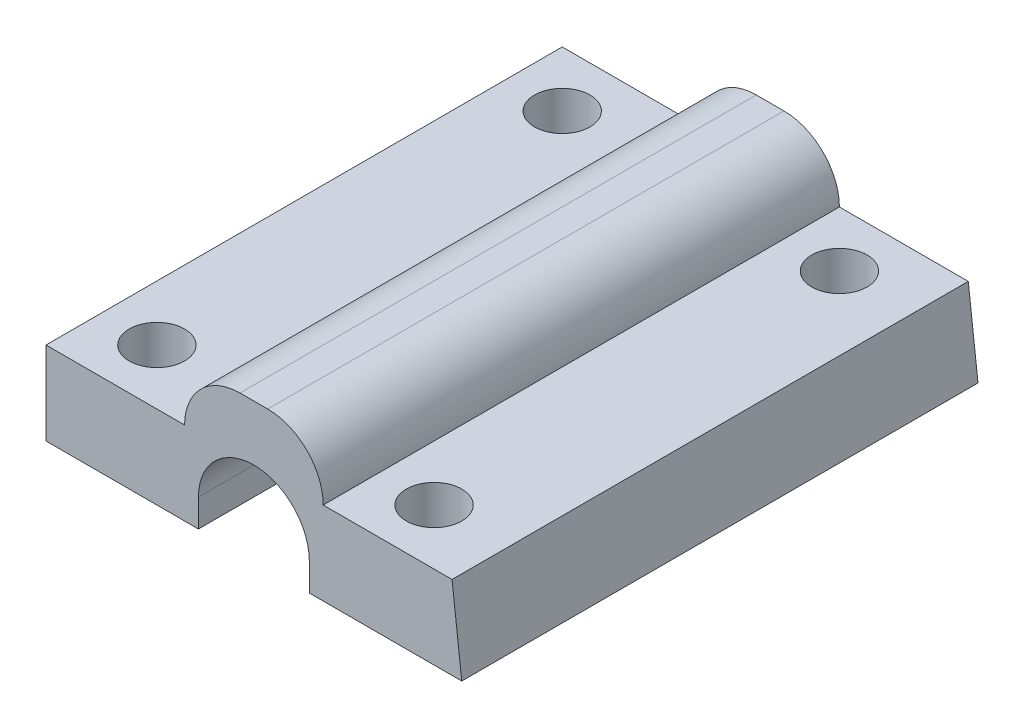
from build123d import *

# Parameters (mm, degrees)
SKETCH1_W           = 30
SKETCH1_H           = 37.25
BOSS_EXTRUDE1_DEPTH = 6
SKETCH2_R           = 2
CUT_EXTRUDE1_DEPTH  = 6
SKETCH3_W           = 10
SKETCH3_H           = 37.25
BOSS_EXTRUDE2_DEPTH = 4
SKETCH4_W           = 8
SKETCH4_H           = 37.25
CUT_EXTRUDE2_DEPTH  = 6
FILLET2_R           = 4
FILLET3_R           = 4
CUT_EXTRUDE3_DEPTH  = 50


with BuildPart() as part:
    # Sketch1 → Boss-Extrude1 (new body)
    with BuildSketch(Plane(origin=(0, 0, 0), x_dir=(1, 0, 0), z_dir=(0, 1, 0))):
        with Locations((2.786458333, -10.239583333)):
            Rectangle(SKETCH1_W, SKETCH1_H)
    extrude(amount=BOSS_EXTRUDE1_DEPTH)

    # Sketch2 → Cut-Extrude1 (cut)
    with BuildSketch(Plane(origin=(0, 6, 0), x_dir=(1, 0, 0), z_dir=(0, 1, 0))):
        with Locations(Location((-8.213541667, -24.864583333, 0), (0, 0, 270))):
            Circle(SKETCH2_R)
        with Locations(Location((11.786458333, 4.385416667, 0), (0, 0, 270))):
            Circle(SKETCH2_R)
        with Locations(Location((11.786458333, -24.864583333, 0), (0, 0, 270))):
            Circle(SKETCH2_R)
        with Locations(Location((-8.213541667, 4.385416667, 0), (0, 0, 270))):
            Circle(SKETCH2_R)
    extrude(amount=-CUT_EXTRUDE1_DEPTH, mode=Mode.SUBTRACT)

    # Sketch3 → Boss-Extrude2 (add)
    with BuildSketch(Plane(origin=(0, 6, 0), x_dir=(1, 0, 0), z_dir=(0, 1, 0))):
        with Locations((2.786458333, -10.239583333)):
            Rectangle(SKETCH3_W, SKETCH3_H)
    extrude(amount=BOSS_EXTRUDE2_DEPTH)

    # Sketch4 → Cut-Extrude2 (cut)
    with BuildSketch(Plane.XZ):
        with Locations((2.786458333, 10.239583333)):
            Rectangle(SKETCH4_W, SKETCH4_H)
    extrude(amount=-CUT_EXTRUDE2_DEPTH, mode=Mode.SUBTRACT)

    # Fillet2
    fillet2_edges = [part.edges().sort_by_distance(p)[0] for p in [
        (6.786458333, 6, 10.239583333),
        (-1.213541667, 6, 10.239583333),
    ]]
    fillet(fillet2_edges, radius=FILLET2_R - 0.0001)  # a hair under: the kernel refuses the full size

    # Fillet3
    fillet3_edges = [part.edges().sort_by_distance(p)[0] for p in [
        (7.786458333, 10, 10.239583333),
        (-2.213541667, 10, 10.239583333),
    ]]
    fillet(fillet3_edges, radius=FILLET3_R - 0.0001)  # a hair under: the kernel refuses the full size

    # Sketch5 → Cut-Extrude3 (cut)
    with BuildSketch(Plane(origin=(0, 0, -8.385416667), x_dir=(-1, 0, 0), z_dir=(0, 0, -1))):
        Polygon((-17.786458333, 0), (-17.085914813, 6), (-17.786458333, 6), align=None)
    extrude(amount=-CUT_EXTRUDE3_DEPTH, mode=Mode.SUBTRACT)


solid = part.part
